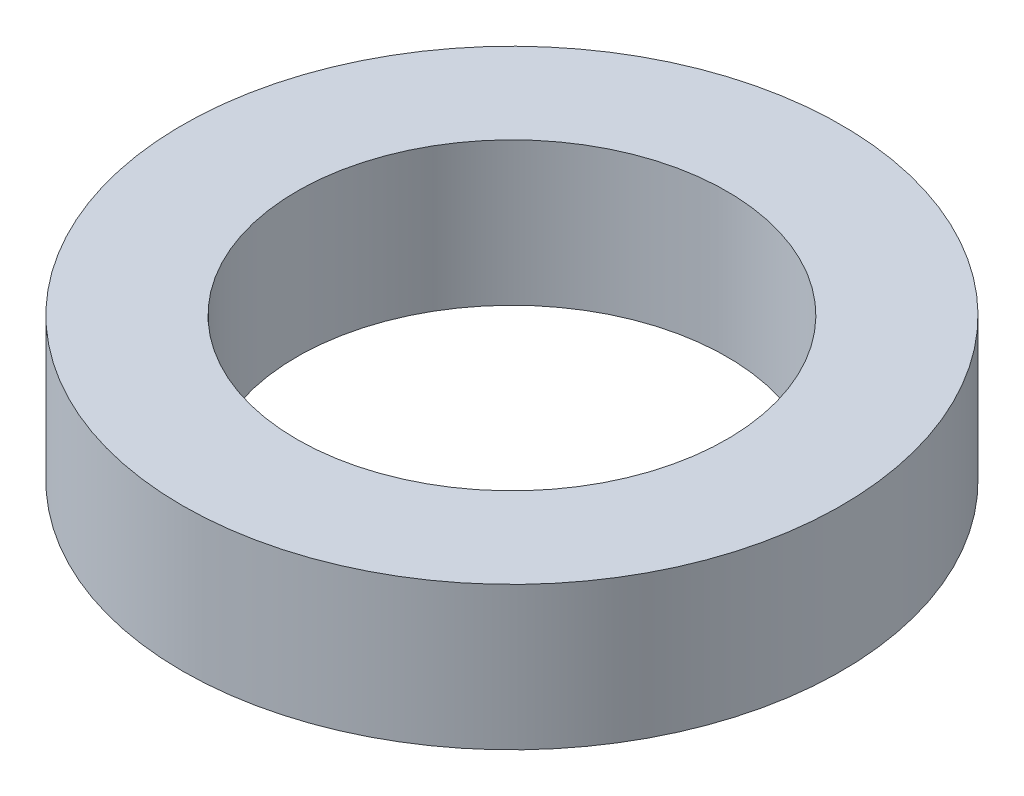
from build123d import *

# Parameters (mm, degrees)
SKETCH1_R           = 57.5
BOSS_EXTRUDE1_DEPTH = 25
SKETCH2_R           = 37.5
CUT_EXTRUDE1_DEPTH  = 86.073497636


with BuildPart() as part:
    # Sketch1 → Boss-Extrude1 (new body)
    with BuildSketch(Plane(origin=(0, 0, 0), x_dir=(1, 0, 0), z_dir=(0, 1, 0))):
        Circle(SKETCH1_R)
    extrude(amount=BOSS_EXTRUDE1_DEPTH)

    # Sketch2 → Cut-Extrude1 (cut, through all)
    with BuildSketch(Plane(origin=(0, 0, 0), x_dir=(1, 0, 0), z_dir=(0, 1, 0))):
        Circle(SKETCH2_R)
    extrude(amount=CUT_EXTRUDE1_DEPTH, mode=Mode.SUBTRACT)


solid = part.part
